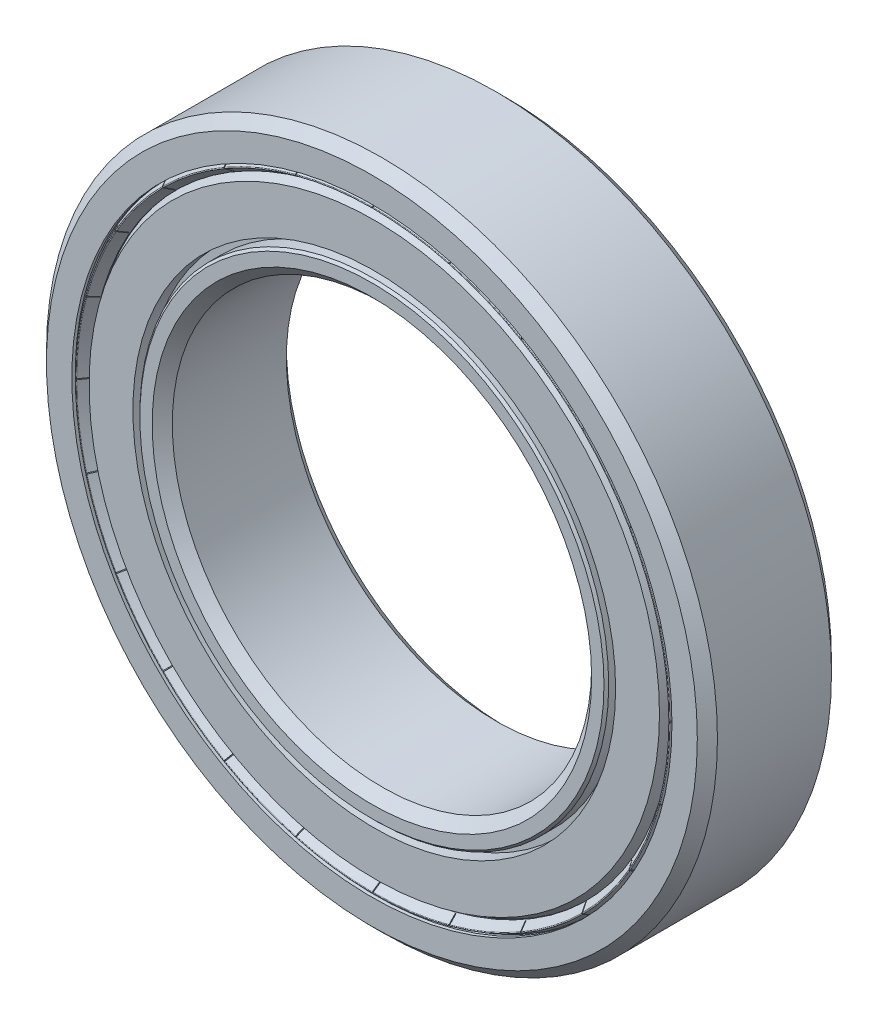
from build123d import *

# Parameters (mm, degrees)
CIRPATTERN1_COUNT  = 12
FILLET1_R          = 0.08
CUT_EXTRUDE1_START = 6.97394
CUT_EXTRUDE1_DEPTH = 51.157487428
CIRPATTERN2_COUNT  = 24


with BuildPart() as part:
    # Sketch3 → Revolve1 (revolve)
    with BuildSketch(Plane(origin=(0, 0, 0), x_dir=(0, 0, -1), z_dir=(1, 0, 0)), mode=Mode.PRIVATE) as revolve1_sk:
        with BuildLine():
            Line((6.8, 40), (-6.8, 40))
            Line((-6.8, 40), (-8, 38.8))
            Line((-8, 38.8), (-8, 35.777581315))
            Line((-8, 35.777581315), (-7.6, 35.777581315))
            Line((-7.6, 35.777581315), (-7.6, 36.763790657))
            Line((-7.6, 36.763790657), (-7.317157288, 37.04663337))
            Line((-7.317157288, 37.04663337), (-2.625, 37.04663337))
            ThreePointArc((-2.625, 37.04663337), (0, 37.75), (2.625, 37.04663337))
            Line((2.625, 37.04663337), (7.317157288, 37.04663337))
            Line((7.317157288, 37.04663337), (7.6, 36.763790657))
            Line((7.6, 36.763790657), (7.6, 35.777581315))
            Line((7.6, 35.777581315), (8, 35.777581315))
            Line((8, 35.777581315), (8, 38.8))
            Line((8, 38.8), (6.8, 40))
        make_face()
        with BuildLine():
            Line((6.8, 25), (-6.8, 25))
            Line((-6.8, 25), (-8, 26.2))
            Line((-8, 26.2), (-8, 27.670523918))
            Line((-8, 27.670523918), (-7.717157288, 27.95336663))
            Line((-7.717157288, 27.95336663), (-2.625, 27.95336663))
            ThreePointArc((-2.625, 27.95336663), (0, 27.25), (2.625, 27.95336663))
            Line((2.625, 27.95336663), (7.717157288, 27.95336663))
            Line((7.717157288, 27.95336663), (8, 27.670523918))
            Line((8, 27.670523918), (8, 26.2))
            Line((8, 26.2), (6.8, 25))
        make_face()
    revolve(revolve1_sk.sketch.rotate(Axis((0, 0, 8), (0, 0, -1)), 90), axis=Axis((0, 0, 8), (0, 0, -1)))


with BuildPart() as body_2:
    # Sketch4 → Revolve2 (revolve)
    with BuildSketch(Plane(origin=(0, 0, 0), x_dir=(0, 0, -1), z_dir=(1, 0, 0))):
        with BuildLine():
            Line((0, 37.75), (0, 27.25))
            ThreePointArc((0, 27.25), (-5.25, 32.5), (0, 37.75))
        make_face()
    revolve(axis=Axis((0, 40, 0), (0, -1, 0)))


with BuildPart() as cirpattern1_1:
    # CirPattern1: pattern copy
    add(body_2.part.rotate(Axis((0, 0, 0), (0, 0, 1)), 1 * 360 / CIRPATTERN1_COUNT))


with BuildPart() as cirpattern1_2:
    # CirPattern1: pattern copy
    add(body_2.part.rotate(Axis((0, 0, 0), (0, 0, 1)), 2 * 360 / CIRPATTERN1_COUNT))


with BuildPart() as cirpattern1_3:
    # CirPattern1: pattern copy
    add(body_2.part.rotate(Axis((0, 0, 0), (0, 0, 1)), 3 * 360 / CIRPATTERN1_COUNT))


with BuildPart() as cirpattern1_4:
    # CirPattern1: pattern copy
    add(body_2.part.rotate(Axis((0, 0, 0), (0, 0, 1)), 4 * 360 / CIRPATTERN1_COUNT))


with BuildPart() as cirpattern1_5:
    # CirPattern1: pattern copy
    add(body_2.part.rotate(Axis((0, 0, 0), (0, 0, 1)), 5 * 360 / CIRPATTERN1_COUNT))


with BuildPart() as cirpattern1_6:
    # CirPattern1: pattern copy
    add(body_2.part.rotate(Axis((0, 0, 0), (0, 0, 1)), 6 * 360 / CIRPATTERN1_COUNT))


with BuildPart() as cirpattern1_7:
    # CirPattern1: pattern copy
    add(body_2.part.rotate(Axis((0, 0, 0), (0, 0, 1)), 7 * 360 / CIRPATTERN1_COUNT))


with BuildPart() as cirpattern1_8:
    # CirPattern1: pattern copy
    add(body_2.part.rotate(Axis((0, 0, 0), (0, 0, 1)), 8 * 360 / CIRPATTERN1_COUNT))


with BuildPart() as cirpattern1_9:
    # CirPattern1: pattern copy
    add(body_2.part.rotate(Axis((0, 0, 0), (0, 0, 1)), 9 * 360 / CIRPATTERN1_COUNT))


with BuildPart() as cirpattern1_10:
    # CirPattern1: pattern copy
    add(body_2.part.rotate(Axis((0, 0, 0), (0, 0, 1)), 10 * 360 / CIRPATTERN1_COUNT))


with BuildPart() as cirpattern1_11:
    # CirPattern1: pattern copy
    add(body_2.part.rotate(Axis((0, 0, 0), (0, 0, 1)), 11 * 360 / CIRPATTERN1_COUNT))


with BuildPart() as body_14:
    # Sketch5 → Revolve3 (revolve)
    with BuildSketch(Plane(origin=(0, 0, 0), x_dir=(0, 0, -1), z_dir=(1, 0, 0)), mode=Mode.PRIVATE) as revolve3_sk:
        Polygon((-5.25, 27.95336663), (-6.072385763, 27.95336663), (-6.072385763, 28.775752393), (-7.717157288, 28.775752393), (-7.717157288, 34.00558627), (-6.072385763, 34.955195552), (-5.25, 34.955195552), align=None)
        Polygon((6.072385763, 34.955195552), (5.25, 34.955195552), (5.25, 27.95336663), (6.072385763, 27.95336663), (6.072385763, 28.775752393), (7.717157288, 28.775752393), (7.717157288, 34.00558627), align=None)
    revolve(revolve3_sk.sketch.rotate(Axis((0, 0, 8), (0, 0, -1)), 90), axis=Axis((0, 0, 8), (0, 0, -1)))


with BuildPart() as body_15:
    # Sketch6 → Revolve4 (revolve)
    with BuildSketch(Plane(origin=(0, 0, 0), x_dir=(0, 0, -1), z_dir=(1, 0, 0)), mode=Mode.PRIVATE) as revolve4_sk:
        Polygon((-6.647880128, 35.777581315), (-7.3, 35.777581315), (-8, 35.373436126), (-6.887880128, 34.594721409), (-6.807880128, 34.594721409), (-6.647880128, 34.622933725), align=None)
    revolve(revolve4_sk.sketch.rotate(Axis((0, 0, 8), (0, 0, -1)), 90), axis=Axis((0, 0, 8), (0, 0, -1)))

    # Fillet1
    fillet1_edges = [body_15.edges().sort_by_distance(p)[0] for p in [
        (-35.373436126, 0, 8),
    ]]
    fillet(fillet1_edges, radius=FILLET1_R)

    # Sketch7 → Cut-Extrude1 (cut, through all)
    with BuildSketch(Plane.XY.offset(CUT_EXTRUDE1_START)):
        Polygon((-0.05, 35.777581315), (-0.05, 35.877581315), (0.05, 35.877581315), (0.05, 35.777581315), (0.05, 34.594721409), (0.05, 34.494721409), (-0.05, 34.494721409), (-0.05, 34.594721409), align=None)
    cut_extrude1 = extrude(amount=CUT_EXTRUDE1_DEPTH, mode=Mode.SUBTRACT)

    # CirPattern2: Cut-Extrude1 ×24 about axis
    cirpattern2_axis = Axis((0, 0, 0), (0, 0, 1))
    for i in range(1, CIRPATTERN2_COUNT):
        add(cut_extrude1.rotate(cirpattern2_axis, i * 360 / CIRPATTERN2_COUNT), mode=Mode.SUBTRACT)


with BuildPart() as body_16:
    # Mirror1: mirrored copy
    add(body_15.part.mirror(Plane.XY))


solid = Compound([part.part, body_2.part, cirpattern1_1.part, cirpattern1_2.part, cirpattern1_3.part, cirpattern1_4.part, cirpattern1_5.part, cirpattern1_6.part, cirpattern1_7.part, cirpattern1_8.part, cirpattern1_9.part, cirpattern1_10.part, cirpattern1_11.part, body_14.part, body_15.part, body_16.part])
